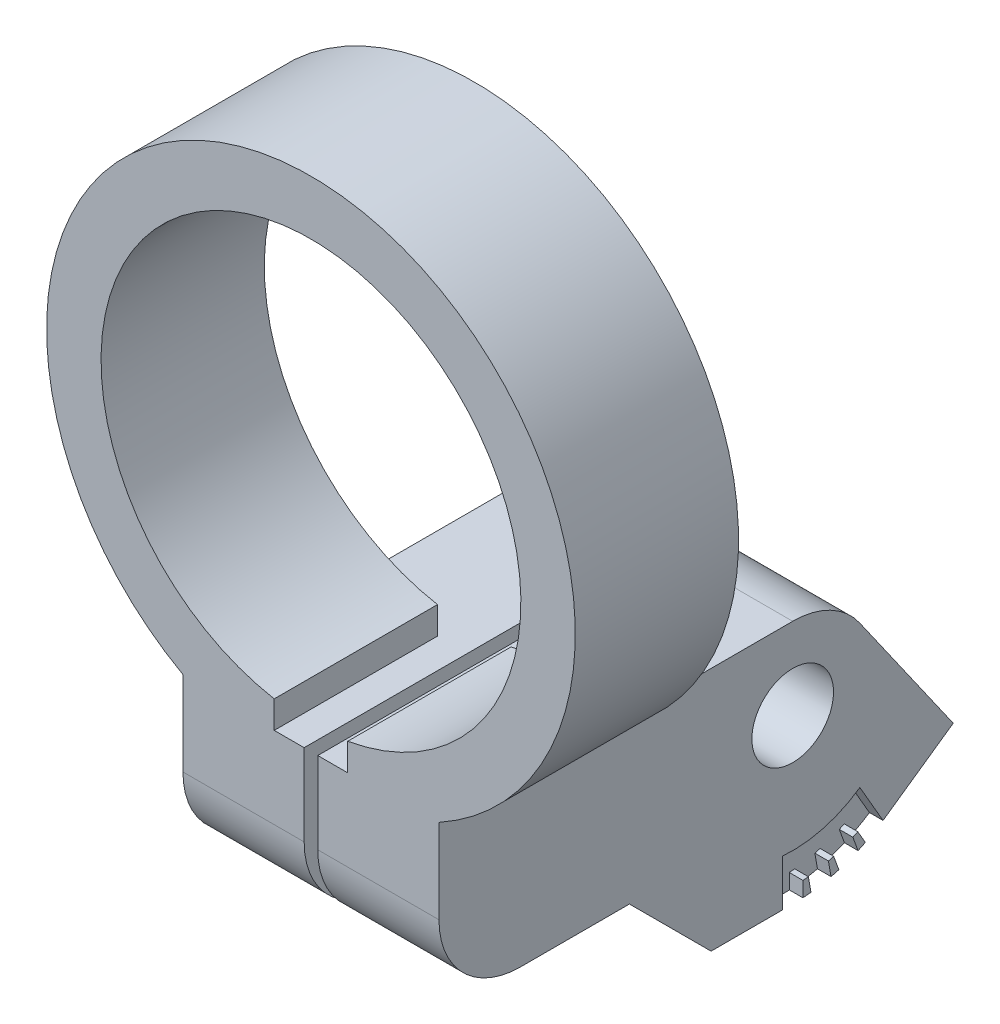
from build123d import *

# Parameters (mm, degrees)
SHAPE_DEPTH       = 6
SKETCH3_W         = 4.454383594
SKETCH3_H         = 6
LEVER_DEPTH       = 10
CUTS_START        = -9.408767
SKETCH2_R         = 1.5
CUTS_DEPTH        = 9.408767
LIMITS_1_DEPTH    = 4.454383594
LIMITS_START      = -4.454383594
LIMITS_2_DEPTH    = 4.454383594
ANGLE_FIX_1_DEPTH = 0.5


with BuildPart() as part:
    # Sketch1 → Shape (new body)
    with BuildSketch(Plane.XY):
        with BuildLine():
            Line((1.35, -7.59596768), (1.35, -8.6))
            Line((1.35, -8.6), (0.25, -8.6))
            Line((0.25, -8.6), (0.25, -14.6))
            Line((0.25, -14.6), (4.704383594, -14.6))
            Line((4.704383594, -14.6), (4.704383594, -8.5))
            ThreePointArc((4.704383594, -8.5), (0, 9.715), (-4.704383594, -8.5))
            Line((-4.704383594, -8.5), (-4.704383594, -14.6))
            Line((-4.704383594, -14.6), (-0.25, -14.6))
            Line((-0.25, -14.6), (-0.25, -8.6))
            Line((-0.25, -8.6), (-1.35, -8.6))
            Line((-1.35, -8.6), (-1.35, -7.59596768))
            ThreePointArc((-1.35, -7.59596768), (0, 7.715), (1.35, -7.59596768))
        make_face()
    extrude(amount=SHAPE_DEPTH)

    # Sketch3 → Lever (add)
    with BuildSketch(Plane(origin=(0, 0, 0), x_dir=(-1, 0, 0), z_dir=(0, 0, -1))):
        with Locations((-2.477191797, -11.6)):
            Rectangle(SKETCH3_W, SKETCH3_H)
        with Locations((2.477191797, -11.6)):
            Rectangle(SKETCH3_W, SKETCH3_H)
    extrude(amount=LEVER_DEPTH)

    # Sketch2 → Cuts (cut)
    with BuildSketch(Plane(origin=(4.704383594, 0, 0), x_dir=(0, 0, -1), z_dir=(1, 0, 0)).offset(CUTS_START)):
        with BuildLine():
            ThreePointArc((-3, -14.6), (-5.121320344, -13.721320344), (-6, -11.6))
            Line((-6, -11.6), (-6, -14.6))
            Line((-6, -14.6), (-3, -14.6))
        make_face()
        with BuildLine():
            Line((10, -8.6), (7, -8.6))
            ThreePointArc((7, -8.6), (9.121320344, -9.478679656), (10, -11.6))
            Line((10, -11.6), (10, -8.6))
        make_face()
        with BuildLine():
            ThreePointArc((10, -11.6), (9.121320344, -13.721320344), (7, -14.6))
            Line((7, -14.6), (10, -14.6))
            Line((10, -14.6), (10, -11.6))
        make_face()
        with Locations(Location((7, -11.6, 0), (0, 0, 90))):
            Circle(SKETCH2_R)
    extrude(amount=CUTS_DEPTH, mode=Mode.SUBTRACT)

    # Sketch5 → Limits 1 (add)
    with BuildSketch(Plane.ZY.offset(4.704383594)):
        with BuildLine():
            ThreePointArc((-4, -16.796152423), (-5.447085729, -17.395554958), (-7, -17.6))
            Line((-7, -17.6), (-4, -17.6))
            Line((-4, -17.6), (-4, -16.796152423))
        make_face()
        with BuildLine():
            Line((-7, -14.6), (-7, -17.6))
            ThreePointArc((-7, -17.6), (-5.447085729, -17.395554958), (-4, -16.796152423))
            Line((-4, -16.796152423), (-4, -14.6))
            Line((-4, -14.6), (-7, -14.6))
        make_face()
        with BuildLine():
            ThreePointArc((-12.437846722, -14.13570957), (-11.596266659, -15.456725658), (-10.441458618, -16.514912266))
            Line((-10.441458618, -16.514912266), (-8.720729309, -14.057456133))
            ThreePointArc((-8.720729309, -14.057456133), (-9.954423259, -12.120944533), (-9.457456133, -9.879270691))
            Line((-9.457456133, -9.879270691), (-12.437846722, -14.13570957))
        make_face()
        with BuildLine():
            Line((-12.898914751, -14.794182957), (-10.441458618, -16.514912266))
            ThreePointArc((-10.441458618, -16.514912266), (-11.596266659, -15.456725658), (-12.437846722, -14.13570957))
            Line((-12.437846722, -14.13570957), (-12.898914751, -14.794182957))
        make_face()
        with BuildLine():
            ThreePointArc((-10.441458618, -16.514912266), (-8.804234797, -17.322301704), (-7, -17.6))
            Line((-7, -17.6), (-7, -14.6))
            ThreePointArc((-7, -14.6), (-7.902117399, -14.461150852), (-8.720729309, -14.057456133))
            Line((-8.720729309, -14.057456133), (-10.441458618, -16.514912266))
        make_face()
        with BuildLine():
            Line((-4, -16.796152423), (-4, -17.6))
            Line((-4, -17.6), (-1, -14.6))
            Line((-1, -14.6), (-1.803847577, -14.6))
            ThreePointArc((-1.803847577, -14.6), (-2.757359313, -15.842640687), (-4, -16.796152423))
        make_face()
        with BuildLine():
            Line((-4, -14.6), (-4, -16.796152423))
            ThreePointArc((-4, -16.796152423), (-2.757359313, -15.842640687), (-1.803847577, -14.6))
            Line((-1.803847577, -14.6), (-4, -14.6))
        make_face()
    extrude(amount=-LIMITS_1_DEPTH)

    # Sketch6 → Limits 2 (add)
    with BuildSketch(Plane(origin=(4.704383594, 0, 0), x_dir=(0, 0, -1), z_dir=(1, 0, 0)).offset(LIMITS_START)):
        with BuildLine():
            Line((7, -14.6), (1, -14.6))
            Line((1, -14.6), (4, -17.6))
            Line((4, -17.6), (7, -17.6))
            ThreePointArc((7, -17.6), (8.804234797, -17.322301704), (10.441458618, -16.514912266))
            Line((10.441458618, -16.514912266), (12.898914751, -14.794182957))
            Line((12.898914751, -14.794182957), (9.457456133, -9.879270691))
            ThreePointArc((9.457456133, -9.879270691), (9.6610325, -12.98524584), (7, -14.6))
        make_face()
    extrude(amount=LIMITS_2_DEPTH)

    # Sketch7 → Angle fix 1 (cut)
    with BuildSketch(Plane.ZY.offset(4.704383594)):
        with BuildLine():
            Line((-8.312844754, -16.885973656), (-8.411191973, -17.443728451))
            Line((-8.411191973, -17.443728451), (-7.672586159, -17.573964585))
            Line((-7.672586159, -17.573964585), (-7.57423894, -17.01620979))
            ThreePointArc((-7.57423894, -17.01620979), (-7.474699486, -17.025839957), (-7.375, -17.033640938))
            Line((-7.375, -17.033640938), (-7.375, -17.6))
            Line((-7.375, -17.6), (-6.625, -17.6))
            Line((-6.625, -17.6), (-6.625, -15.886269614))
            ThreePointArc((-6.625, -15.886269614), (-8.113605815, -15.75603348), (-9.467894333, -15.124518373))
            Line((-9.467894333, -15.124518373), (-10.324759526, -16.608652423))
            Line((-10.324759526, -16.608652423), (-9.675240474, -16.983652423))
            Line((-9.675240474, -16.983652423), (-9.392060943, -16.493171087))
            ThreePointArc((-9.392060943, -16.493171087), (-9.301818164, -16.536264983), (-9.210799385, -16.57769474))
            Line((-9.210799385, -16.57769474), (-9.404505593, -17.109898171))
            Line((-9.404505593, -17.109898171), (-8.699736127, -17.366413278))
            Line((-8.699736127, -17.366413278), (-8.50602992, -16.834209847))
            ThreePointArc((-8.50602992, -16.834209847), (-8.409674955, -16.860978556), (-8.312844754, -16.885973656))
        make_face()
    angle_fix_1 = extrude(amount=-ANGLE_FIX_1_DEPTH, mode=Mode.SUBTRACT)

    # Angle fix 2: Angle fix 1 across plane
    add(angle_fix_1.mirror(Plane(origin=(0, 0, 0), x_dir=(0, 0, 1), z_dir=(1, 0, 0))), mode=Mode.SUBTRACT)


solid = part.part
